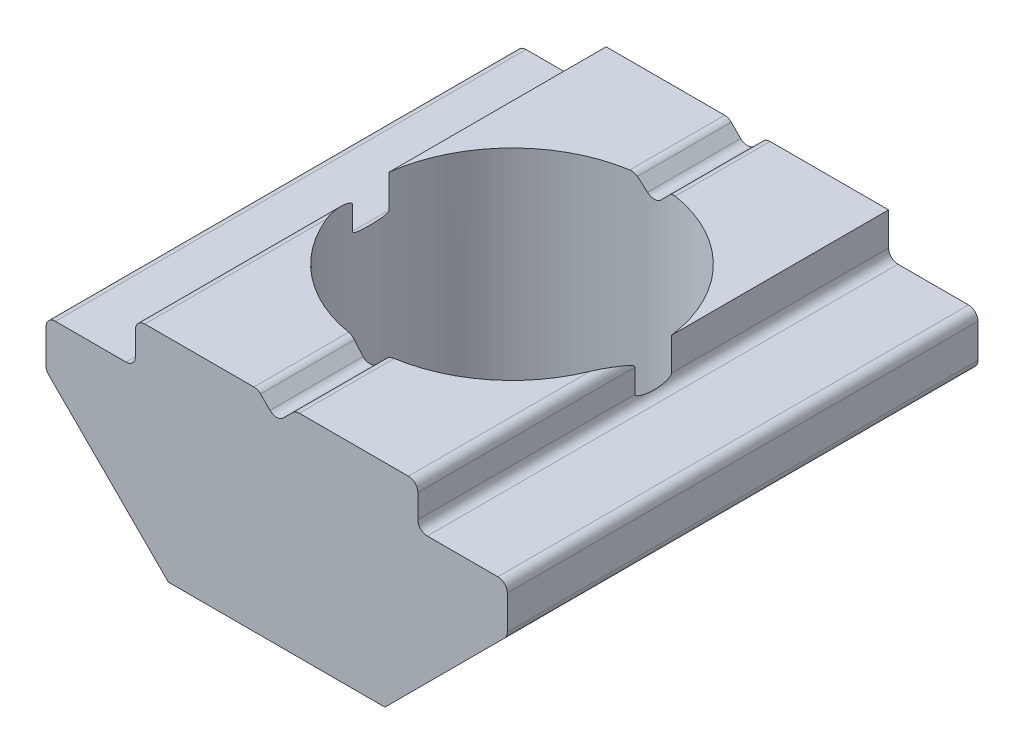
from build123d import *

# Parameters (mm, degrees)
EXTRUDE_BODY_DEPTH = 10
SKETCH2_W          = 1.9
SKETCH2_H          = 0.9
CUT_EXTRUDE1_DEPTH = 12.703418304
SKETCH3_W          = 1.9
SKETCH3_H          = 0.9
CUT_EXTRUDE2_DEPTH = 12.703418304
CUT_EXTRUDE3_DEPTH = 12.703418304
HOLE_REVOLVE_D     = 6.05
EDGE_FILLETS_R     = 0.2


with BuildPart() as part:
    # Sketch1 → Extrude Body (new body)
    with BuildSketch(Plane.XY.offset(5)):
        Polygon((4.9, -1), (4.9, 0.9), (-4.9, 0.9), (-4.9, -1), (-2.3, -3.6), (2.3, -3.6), align=None)
    extrude(amount=-EXTRUDE_BODY_DEPTH)

    # Sketch2 → Cut-Extrude1 (cut, through all)
    with BuildSketch(Plane(origin=(0, 0, -5), x_dir=(-1, 0, 0), z_dir=(0, 0, -1))):
        with Locations((3.95, 0.45)):
            Rectangle(SKETCH2_W, SKETCH2_H)
    extrude(amount=-CUT_EXTRUDE1_DEPTH, mode=Mode.SUBTRACT)

    # Sketch3 → Cut-Extrude2 (cut, through all)
    with BuildSketch(Plane(origin=(0, 0, -5), x_dir=(-1, 0, 0), z_dir=(0, 0, -1))):
        with Locations((-3.95, 0.45)):
            Rectangle(SKETCH3_W, SKETCH3_H)
    extrude(amount=-CUT_EXTRUDE2_DEPTH, mode=Mode.SUBTRACT)

    # Sketch4 → Cut-Extrude3 (cut, through all)
    with BuildSketch(Plane(origin=(0, 0, -5), x_dir=(-1, 0, 0), z_dir=(0, 0, -1))):
        Polygon((0.4, 0.9), (-0.4, 0.9), (0, 0.5), align=None)
    extrude(amount=-CUT_EXTRUDE3_DEPTH, mode=Mode.SUBTRACT)

    # Hole Revolve (through all)
    with Locations(Plane(origin=(0, -3.6, 0), x_dir=(-1, 0, 0), z_dir=(0, -1, 0))):
        with Locations((0, 0)):
            Hole(HOLE_REVOLVE_D / 2)

    # Edge Fillets
    # the kernel refuses this fillet: 0.2 mm, written as the material it adds along each edge
    with BuildSketch(Plane(origin=(3, 0, -5), x_dir=(1, 0, 0), z_dir=(0, 0, 1))) as edge_fillets_piece_1_section:
        with BuildLine():
            CenterArc((EDGE_FILLETS_R, EDGE_FILLETS_R), EDGE_FILLETS_R, 180, 90)
            Line((0, EDGE_FILLETS_R), (0, 0))
            Line((0, 0), (EDGE_FILLETS_R, 0))
        make_face()
    edge_fillets_piece_1 = extrude(amount=5.111895633, mode=Mode.PRIVATE)
    edge_fillets_piece_1 = edge_fillets_piece_1 - Plane(origin=(0, 0.044194975, 0), x_dir=(1, 0, 0), z_dir=(0, 1, 0)) * Cylinder(3.025, 12, mode=Mode.PRIVATE)
    add(edge_fillets_piece_1)
    with BuildSketch(Plane(origin=(3, 0, -0.111895633), x_dir=(1, 0, 0), z_dir=(0, 0, 1))) as edge_fillets_piece_2_section:
        with BuildLine():
            CenterArc((EDGE_FILLETS_R, EDGE_FILLETS_R), EDGE_FILLETS_R, 180, 90)
            Line((0, EDGE_FILLETS_R), (0, 0))
            Line((0, 0), (EDGE_FILLETS_R, 0))
        make_face()
    edge_fillets_piece_2 = extrude(amount=5.111895633, mode=Mode.PRIVATE)
    edge_fillets_piece_2 = edge_fillets_piece_2 - Plane(origin=(0, 0.044194976, 0), x_dir=(1, 0, 0), z_dir=(0, 1, 0)) * Cylinder(3.025, 12, mode=Mode.PRIVATE)
    add(edge_fillets_piece_2)
    with BuildSketch(Plane(origin=(-3, 0, -0.111895633), x_dir=(-1, 0, 0), z_dir=(0, 0, 1))) as edge_fillets_piece_3_section:
        with BuildLine():
            CenterArc((EDGE_FILLETS_R, -EDGE_FILLETS_R), EDGE_FILLETS_R, 90, 90)
            Line((0, -EDGE_FILLETS_R), (0, 0))
            Line((0, 0), (EDGE_FILLETS_R, 0))
        make_face()
    edge_fillets_piece_3 = extrude(amount=5.111895633, mode=Mode.PRIVATE)
    edge_fillets_piece_3 = edge_fillets_piece_3 - Plane(origin=(0, 0.044194976, 0), x_dir=(1, 0, 0), z_dir=(0, 1, 0)) * Cylinder(3.025, 12, mode=Mode.PRIVATE)
    add(edge_fillets_piece_3)
    with BuildSketch(Plane(origin=(-3, 0, -5), x_dir=(-1, 0, 0), z_dir=(0, 0, 1))) as edge_fillets_piece_4_section:
        with BuildLine():
            CenterArc((EDGE_FILLETS_R, -EDGE_FILLETS_R), EDGE_FILLETS_R, 90, 90)
            Line((0, -EDGE_FILLETS_R), (0, 0))
            Line((0, 0), (EDGE_FILLETS_R, 0))
        make_face()
    edge_fillets_piece_4 = extrude(amount=5.111895633, mode=Mode.PRIVATE)
    edge_fillets_piece_4 = edge_fillets_piece_4 - Plane(origin=(0, 0.044194976, 0), x_dir=(1, 0, 0), z_dir=(0, 1, 0)) * Cylinder(3.025, 12, mode=Mode.PRIVATE)
    add(edge_fillets_piece_4)
    with BuildSketch(Plane(origin=(0, 0.5, 2.525), x_dir=(-0.7071067811865454, 0.7071067811865497, 0), z_dir=(0, 0, 1))) as edge_fillets_piece_5_section:
        with BuildLine():
            CenterArc((EDGE_FILLETS_R, -EDGE_FILLETS_R), EDGE_FILLETS_R, 90, 90)
            Line((0, -EDGE_FILLETS_R), (0, 0))
            Line((0, 0), (EDGE_FILLETS_R, 0))
        make_face()
    edge_fillets_piece_5 = extrude(amount=2.475, mode=Mode.PRIVATE)
    edge_fillets_piece_5 = edge_fillets_piece_5 - Plane(origin=(0, 0.564041319, 0), x_dir=(1, 0, 0), z_dir=(0, 1, 0)) * Cylinder(3.025, 6, mode=Mode.PRIVATE)
    add(edge_fillets_piece_5)
    with BuildSketch(Plane(origin=(0, 0.5, -5), x_dir=(-0.7071067811865455, 0.7071067811865496, 0), z_dir=(0, 0, 1))) as edge_fillets_piece_6_section:
        with BuildLine():
            CenterArc((EDGE_FILLETS_R, -EDGE_FILLETS_R), EDGE_FILLETS_R, 90, 90)
            Line((0, -EDGE_FILLETS_R), (0, 0))
            Line((0, 0), (EDGE_FILLETS_R, 0))
        make_face()
    edge_fillets_piece_6 = extrude(amount=2.475, mode=Mode.PRIVATE)
    edge_fillets_piece_6 = edge_fillets_piece_6 - Plane(origin=(0, 0.564041319, 0), x_dir=(1, 0, 0), z_dir=(0, 1, 0)) * Cylinder(3.025, 6, mode=Mode.PRIVATE)
    add(edge_fillets_piece_6)
    # the kernel refuses this fillet: 0.2 mm, written as the material it takes off along each edge
    with BuildSketch(Plane(origin=(4.9, 0, -5.5), x_dir=(0, -1, 0), z_dir=(0, 0, 1))) as edge_fillets_2_piece_1:
        with BuildLine():
            CenterArc((EDGE_FILLETS_R, -EDGE_FILLETS_R), EDGE_FILLETS_R, 90, 90)
            Line((0, -EDGE_FILLETS_R), (0, 0))
            Line((0, 0), (EDGE_FILLETS_R, 0))
        make_face()
    extrude(amount=11, mode=Mode.SUBTRACT)
    with BuildSketch(Plane(origin=(-4.9, -1, 5.207106781), x_dir=(0.7071067811865468, -0.7071067811865481, 0), z_dir=(0, 0, -1)), Plane(origin=(4.9, -1, 5.207106781), x_dir=(0, 1, 0), z_dir=(0, 0, -1))) as edge_fillets_2_piece_2:
        with BuildLine():
            CenterArc((EDGE_FILLETS_R * 0.414213562373, -EDGE_FILLETS_R), EDGE_FILLETS_R, 90, 45)
            Line((-EDGE_FILLETS_R * 0.292893218813, -EDGE_FILLETS_R * 0.292893218813), (0, 0))
            Line((0, 0), (EDGE_FILLETS_R * 0.414213562373, 0))
        make_face()
    extrude(amount=10.414213562, mode=Mode.SUBTRACT)
    with BuildSketch(Plane(origin=(3, 0.9, -0.111895633), x_dir=(-1, 0, 0), z_dir=(0, 0, 1)), Plane(origin=(-3, 0.9, -0.111895633), x_dir=(0, -1, 0), z_dir=(0, 0, 1))) as edge_fillets_2_piece_3:
        with BuildLine():
            CenterArc((EDGE_FILLETS_R, EDGE_FILLETS_R), EDGE_FILLETS_R, 180, 90)
            Line((0, EDGE_FILLETS_R), (0, 0))
            Line((0, 0), (EDGE_FILLETS_R, 0))
        make_face()
    extrude(amount=5.611895633, mode=Mode.SUBTRACT)
    with BuildSketch(Plane(origin=(0.4, 0.9, -5.207106781), x_dir=(1, 0, 0), z_dir=(0, 0, 1)), Plane(origin=(-0.4, 0.9, -5.207106781), x_dir=(0.7071067811865449, -0.7071067811865502, 0), z_dir=(0, 0, 1))) as edge_fillets_2_piece_4:
        with BuildLine():
            CenterArc((EDGE_FILLETS_R * 0.414213562373, -EDGE_FILLETS_R), EDGE_FILLETS_R, 90, 45)
            Line((-EDGE_FILLETS_R * 0.292893218813, -EDGE_FILLETS_R * 0.292893218813), (0, 0))
            Line((0, 0), (EDGE_FILLETS_R * 0.414213562373, 0))
        make_face()
    extrude(amount=2.415776469, mode=Mode.SUBTRACT)
    with BuildSketch(Plane(origin=(-0.4, 0.9, 2.791330312), x_dir=(-1, 0, 0), z_dir=(0, 0, 1)), Plane(origin=(0.4, 0.9, 2.791330312), x_dir=(-0.7071067811865465, -0.7071067811865485, 0), z_dir=(0, 0, 1))) as edge_fillets_2_piece_5:
        with BuildLine():
            CenterArc((EDGE_FILLETS_R * 0.414213562373, EDGE_FILLETS_R), EDGE_FILLETS_R, 225, 45)
            Line((-EDGE_FILLETS_R * 0.292893218813, EDGE_FILLETS_R * 0.292893218813), (0, 0))
            Line((0, 0), (EDGE_FILLETS_R * 0.414213562373, 0))
        make_face()
    extrude(amount=2.415776469, mode=Mode.SUBTRACT)
    with BuildSketch(Plane(origin=(-4.9, 0, -5.5), x_dir=(0, -1, 0), z_dir=(0, 0, 1))) as edge_fillets_2_piece_6:
        with BuildLine():
            CenterArc((EDGE_FILLETS_R, EDGE_FILLETS_R), EDGE_FILLETS_R, 180, 90)
            Line((0, EDGE_FILLETS_R), (0, 0))
            Line((0, 0), (EDGE_FILLETS_R, 0))
        make_face()
    extrude(amount=11, mode=Mode.SUBTRACT)
    with BuildSketch(Plane(origin=(-2.3, -3.6, -1.757740541), x_dir=(-0.7071067811865448, 0.7071067811865502, 0), z_dir=(0, 0, -1))) as edge_fillets_2_piece_7:
        with BuildLine():
            CenterArc((EDGE_FILLETS_R * 0.414213562373, EDGE_FILLETS_R), EDGE_FILLETS_R, 225, 45)
            Line((-EDGE_FILLETS_R * 0.292893218813, EDGE_FILLETS_R * 0.292893218813), (0, 0))
            Line((0, 0), (EDGE_FILLETS_R * 0.414213562373, 0))
        make_face()
    extrude(amount=3.44936624, mode=Mode.SUBTRACT)
    with BuildSketch(Plane(origin=(2.3, -3.6, -1.757740541), x_dir=(0.7071067811865476, 0.7071067811865476, 0), z_dir=(0, 0, -1))) as edge_fillets_2_piece_8:
        with BuildLine():
            CenterArc((EDGE_FILLETS_R * 0.414213562373, -EDGE_FILLETS_R), EDGE_FILLETS_R, 90, 45)
            Line((-EDGE_FILLETS_R * 0.292893218813, -EDGE_FILLETS_R * 0.292893218813), (0, 0))
            Line((0, 0), (EDGE_FILLETS_R * 0.414213562373, 0))
        make_face()
    extrude(amount=3.44936624, mode=Mode.SUBTRACT)


solid = part.part
